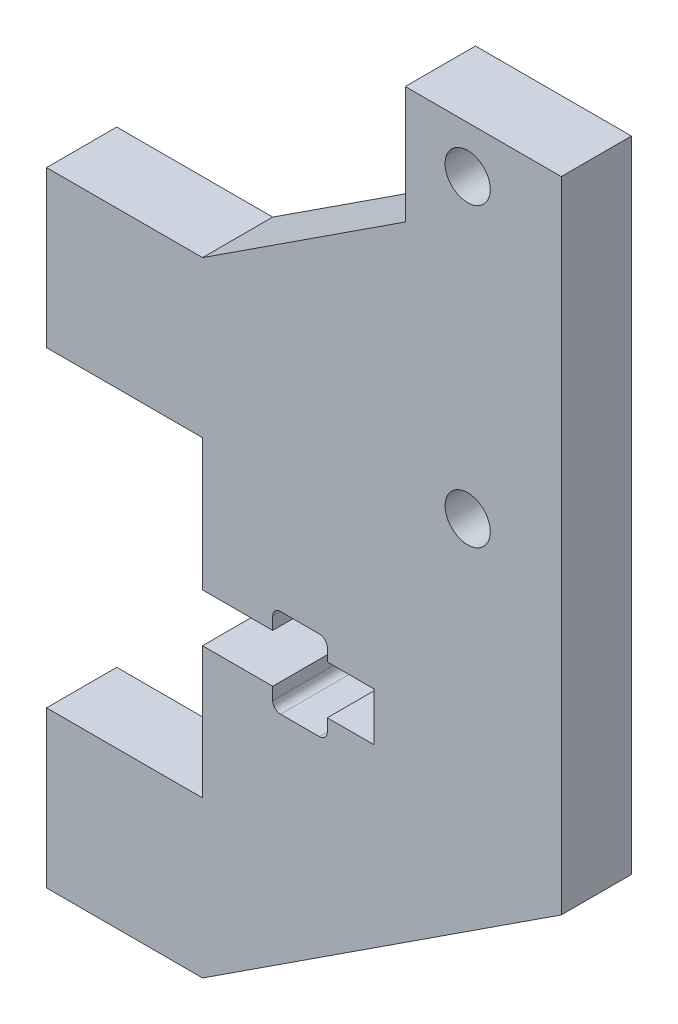
from build123d import *

# Parameters (mm, degrees)
BOSS_EXTRUDE1_DEPTH = 4.5
SCREW_CUTOUT_DEPTH  = 51.737067318
SKETCH3_R           = 1.45
CUT_EXTRUDE2_DEPTH  = 51.737067318


with BuildPart() as part:
    # Sketch1 → Boss-Extrude1 (new body)
    with BuildSketch(Plane.XY):
        Polygon((13, 3.47826087), (0, -5), (-10, -5), (-10, -15), (0, -15), (0, -35), (-10, -35), (-10, -45), (0, -45), (23, -30), (23, 11), (13, 11), align=None)
    extrude(amount=BOSS_EXTRUDE1_DEPTH)

    # Sketch2 → screw-cutout (cut, through all)
    with BuildSketch(Plane.XY.offset(4.5)):
        with BuildLine():
            Line((0, -26.55), (0, -23.45))
            Line((0, -23.45), (4.5, -23.45))
            Line((4.5, -23.45), (4.5, -22.65))
            ThreePointArc((4.5, -22.65), (4.646446609, -22.296446609), (5, -22.15))
            Line((5, -22.15), (7.5, -22.15))
            ThreePointArc((7.5, -22.15), (7.853553391, -22.296446609), (8, -22.65))
            Line((8, -22.65), (8, -23.45))
            Line((8, -23.45), (11, -23.45))
            Line((11, -23.45), (11, -26.55))
            Line((11, -26.55), (8, -26.55))
            Line((8, -26.55), (8, -27.35))
            ThreePointArc((8, -27.35), (7.853553391, -27.703553391), (7.5, -27.85))
            Line((7.5, -27.85), (5, -27.85))
            ThreePointArc((5, -27.85), (4.646446609, -27.703553391), (4.5, -27.35))
            Line((4.5, -27.35), (4.5, -26.55))
            Line((4.5, -26.55), (0, -26.55))
        make_face()
    extrude(amount=-SCREW_CUTOUT_DEPTH, mode=Mode.SUBTRACT)

    # Sketch3 → Cut-Extrude2 (cut, through all)
    with BuildSketch(Plane.XY.offset(4.5)):
        with Locations((17, 8)):
            Circle(SKETCH3_R)
        with Locations((17, -11)):
            Circle(SKETCH3_R)
    extrude(amount=-CUT_EXTRUDE2_DEPTH, mode=Mode.SUBTRACT)


solid = part.part
